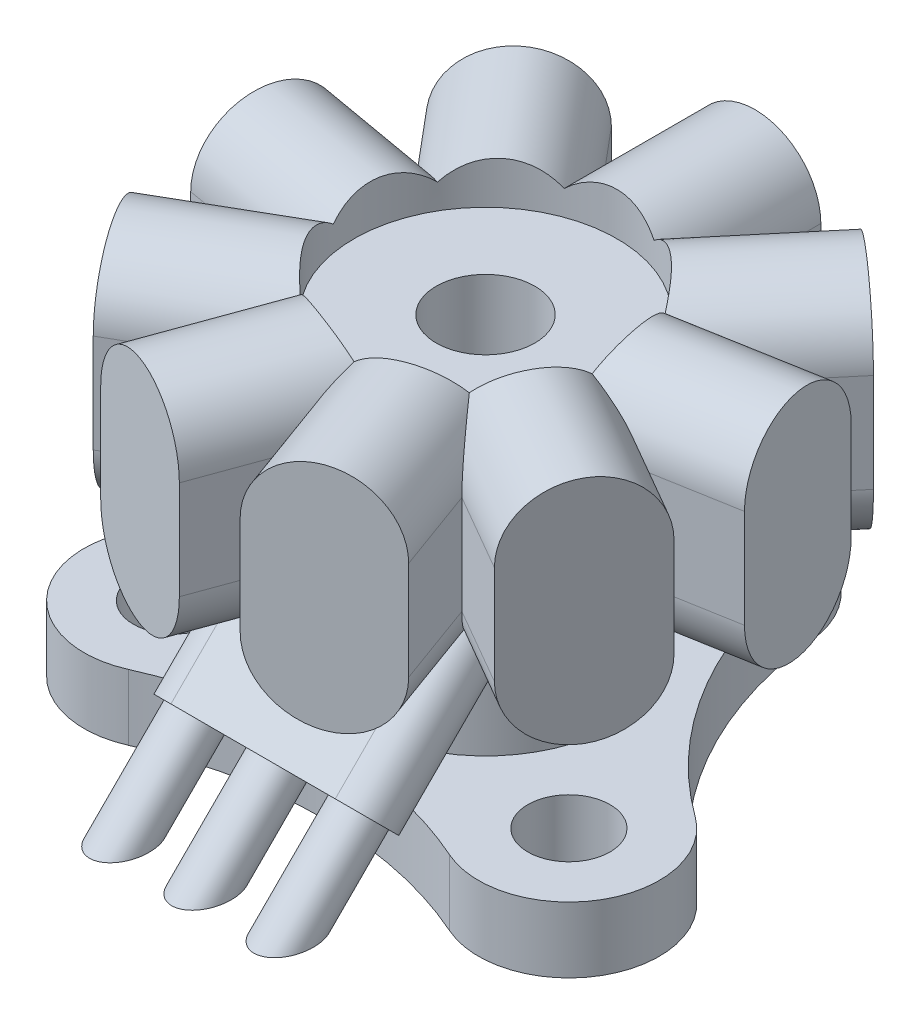
from build123d import *

# Parameters (mm, degrees)
SKETCH1_R                       = 0.625
SKETCH1_R_2                     = 0.75
BOSS_EXTRUDE1_DEPTH             = 1
SKETCH2_R                       = 2
SKETCH2_R_2                     = 0.75
BOSS_EXTRUDE2_DEPTH             = 4.4
BOSS_EXTRUDE3_START             = -1.5
BOSS_EXTRUDE3_DEPTH             = 2.6
CIRPATTERN1_COUNT               = 9
SKETCH5_R                       = 2
SKETCH5_R_2                     = 1
CUT_EXTRUDE_THIN1_DEPTH         = 9.46862028
BOSS_EXTRUDE4_REACH             = 10.897
BOSS_EXTRUDE4_DIRECTION_2_DEPTH = 1.5
BOSS_EXTRUDE5_OUTLINE_R         = 0.375
BOSS_EXTRUDE5_DEPTH             = 1.125
BOSS_EXTRUDE5_START             = -3.3750001
BOSS_EXTRUDE5_2_OUTLINE_R       = 0.375
BOSS_EXTRUDE5_2_DEPTH           = 0.7500001
BOSS_EXTRUDE5_START_2           = -2
BOSS_EXTRUDE5_3_OUTLINE_W       = 6
BOSS_EXTRUDE5_3_OUTLINE_H       = 4
BOSS_EXTRUDE5_3_DEPTH           = 2


with BuildPart() as part:
    # Sketch1 → Boss-Extrude1 (new body)
    with BuildSketch(Plane(origin=(0, 0, 0), x_dir=(1, 0, 0), z_dir=(0, 1, 0))):
        with BuildLine():
            ThreePointArc((1.367474373, 3.607763859), (0, 4.839101615), (-1.367474373, 3.607763859))
            ThreePointArc((-1.367474373, 3.607763859), (-2.138482849, 1.234653648), (-3.808152339, -0.619614384))
            ThreePointArc((-3.808152339, -0.619614384), (-4.19078493, -2.419550808), (-2.440677966, -2.988149475))
            ThreePointArc((-2.440677966, -2.988149475), (0, -2.469307297), (2.440677966, -2.988149475))
            ThreePointArc((2.440677966, -2.988149475), (4.19078493, -2.419550808), (3.808152339, -0.619614384))
            ThreePointArc((3.808152339, -0.619614384), (2.138482849, 1.234653648), (1.367474373, 3.607763859))
        make_face()
        with Locations(Location((0, 3.464101615, 0), (0, 0, 270))):
            Circle(SKETCH1_R, mode=Mode.SUBTRACT)
        with Locations(Location((3, -1.732050808, 0), (0, 0, 270))):
            Circle(SKETCH1_R, mode=Mode.SUBTRACT)
        with Locations(Location((-3, -1.732050808, 0), (0, 0, 270))):
            Circle(SKETCH1_R, mode=Mode.SUBTRACT)
        with Locations(Location((0, 0, 0), (0, 0, 270))):
            Circle(SKETCH1_R_2, mode=Mode.SUBTRACT)
    extrude(amount=BOSS_EXTRUDE1_DEPTH)

    # Sketch2 → Boss-Extrude2 (add)
    with BuildSketch(Plane(origin=(0, 1, 0), x_dir=(1, 0, 0), z_dir=(0, 1, 0))):
        with Locations(Location((0, 0, 0), (0, 0, 90))):
            Circle(SKETCH2_R)
        with Locations(Location((0, 0, 0), (0, 0, 90))):
            Circle(SKETCH2_R_2, mode=Mode.SUBTRACT)
    extrude(amount=BOSS_EXTRUDE2_DEPTH)

    # Sketch3 → Boss-Extrude3 (add)
    with BuildSketch(Plane.XY.offset(BOSS_EXTRUDE3_START)):
        with BuildLine():
            Line((1, 5.05), (1, 3.55))
            ThreePointArc((1, 3.55), (0, 2.55), (-1, 3.55))
            Line((-1, 3.55), (-1, 5.05))
            ThreePointArc((-1, 5.05), (0, 6.05), (1, 5.05))
        make_face()
    boss_extrude3 = extrude(amount=-BOSS_EXTRUDE3_DEPTH)

    # CirPattern1: Boss-Extrude3 ×9 about axis
    cirpattern1_axis = Axis((0, 0, 0), (0, 1, 0))
    for i in range(1, CIRPATTERN1_COUNT):
        add(boss_extrude3.rotate(cirpattern1_axis, i * 360 / CIRPATTERN1_COUNT))

    # Sketch5 → Cut-Extrude-Thin1 (cut, through all)
    with BuildSketch(Plane(origin=(0, 5.4, 0), x_dir=(1, 0, 0), z_dir=(0, 1, 0))):
        Circle(SKETCH5_R)
        Circle(SKETCH5_R_2, mode=Mode.SUBTRACT)
    extrude(amount=CUT_EXTRUDE_THIN1_DEPTH, mode=Mode.SUBTRACT)

    # Sketch6 → Boss-Extrude4 (add, up to next)
    with BuildSketch(Plane(origin=(0, 0, 0), x_dir=(-1, 0, 0), z_dir=(0, 0.7071067811865475, -0.7071067811865477)), mode=Mode.PRIVATE) as boss_extrude4_sk1:
        with BuildLine():
            Line((1.25, 2.5), (-1.25, 2.5))
            ThreePointArc((-1.25, 2.5), (-1.75, 3), (-1.25, 3.5))
            Line((-1.25, 3.5), (1.25, 3.5))
            ThreePointArc((1.25, 3.5), (1.75, 3), (1.25, 2.5))
        make_face()
    boss_extrude4_tool1 = extrude(boss_extrude4_sk1.sketch, amount=BOSS_EXTRUDE4_REACH, mode=Mode.PRIVATE) - part.part
    add(boss_extrude4_tool1.solids().sort_by_distance((0, 2.12132, 2.12132))[0])

    # Sketch6 → Boss-Extrude4 direction 2 (add)
    with BuildSketch(Plane(origin=(0, 0, 0), x_dir=(-1, 0, 0), z_dir=(0, 0.7071067811865475, -0.7071067811865477))):
        with BuildLine():
            Line((1.25, 2.5), (-1.25, 2.5))
            ThreePointArc((-1.25, 2.5), (-1.75, 3), (-1.25, 3.5))
            Line((-1.25, 3.5), (1.25, 3.5))
            ThreePointArc((1.25, 3.5), (1.75, 3), (1.25, 2.5))
        make_face()
    extrude(amount=-BOSS_EXTRUDE4_DIRECTION_2_DEPTH)

    # Boss-Extrude5: read off the stored shape, not the designer's step
    # Boss-Extrude5 outline → Boss-Extrude5 (add)
    with BuildSketch(Plane(origin=(0, -1.060660172, 1.060660172), x_dir=(1, 0, 0), z_dir=(0, -0.7071067811865476, 0.7071067811865476))):
        with Locations((0, 3)):
            Circle(BOSS_EXTRUDE5_OUTLINE_R)
        with Locations((1.25, 3)):
            Circle(BOSS_EXTRUDE5_OUTLINE_R)
        with Locations((-1.25, 3)):
            Circle(BOSS_EXTRUDE5_OUTLINE_R)
    extrude(amount=BOSS_EXTRUDE5_DEPTH)

    # Boss-Extrude5 2 outline → Boss-Extrude5 2 (add)
    with BuildSketch(Plane(origin=(0, 0, 0), x_dir=(1, 0, 0), z_dir=(0, 0.7071067811865476, -0.7071067811865476)).offset(BOSS_EXTRUDE5_START)):
        with Locations((0, -3)):
            Circle(BOSS_EXTRUDE5_2_OUTLINE_R)
        with Locations((1.25, -3)):
            Circle(BOSS_EXTRUDE5_2_OUTLINE_R)
        with Locations((-1.25, -3)):
            Circle(BOSS_EXTRUDE5_2_OUTLINE_R)
    extrude(amount=BOSS_EXTRUDE5_2_DEPTH)

    # Boss-Extrude5 3 outline → Boss-Extrude5 3 (cut)
    with BuildSketch(Plane(origin=(0, 0, 0), x_dir=(1, 0, 0), z_dir=(0, 1, 0)).offset(BOSS_EXTRUDE5_START_2)):
        with Locations((0, -4)):
            Rectangle(BOSS_EXTRUDE5_3_OUTLINE_W, BOSS_EXTRUDE5_3_OUTLINE_H)
    extrude(amount=BOSS_EXTRUDE5_3_DEPTH, mode=Mode.SUBTRACT)


solid = part.part
